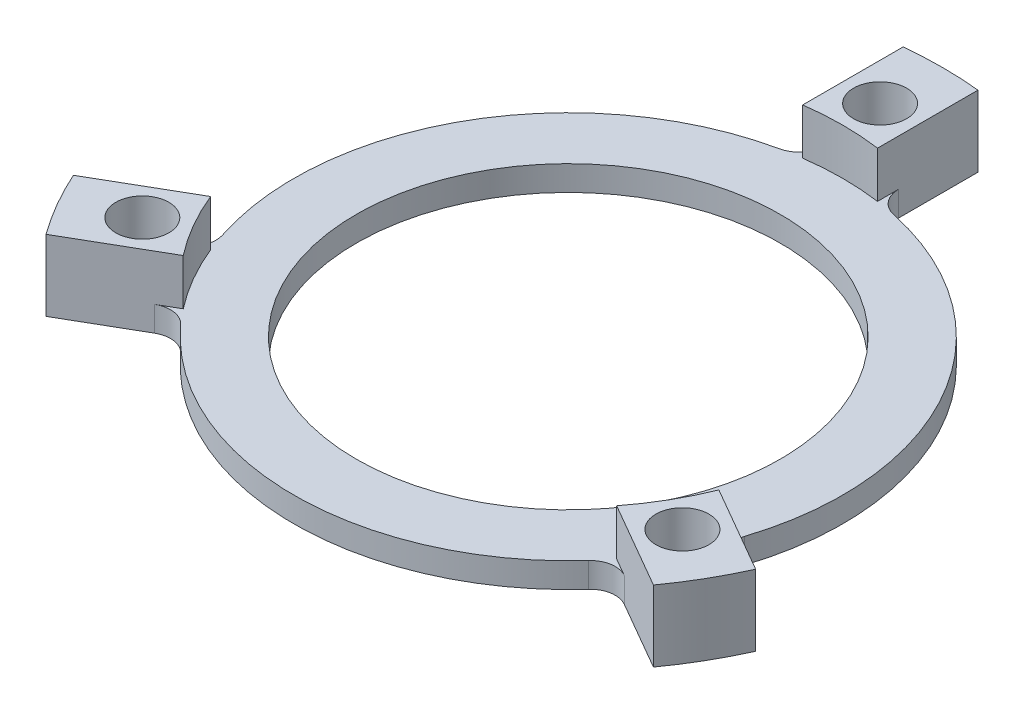
from build123d import *

# Parameters (mm, degrees)
SKETCH1_R             = 1.0635
BOSS_EXTRUDE1_DEPTH   = 2.85
BOSS_EXTRUDE1_2_DEPTH = 2.85
BOSS_EXTRUDE1_3_DEPTH = 2.85
SKETCH1_3_R           = 8.5
BOSS_EXTRUDE2_DEPTH   = 1
FILLET1_R             = 1


with BuildPart() as part:
    # Sketch1 → Boss-Extrude1 (new body)
    with BuildSketch(Plane(origin=(0, 0, 0), x_dir=(1, 0, 0), z_dir=(0, 1, 0))):
        with BuildLine():
            ThreePointArc((-1.5, 10.897247359), (0, 11), (1.5, 10.897247359))
            Line((1.5, 10.897247359), (1.5, 14.924811557))
            ThreePointArc((1.5, 14.924811557), (0, 15), (-1.5, 14.924811557))
            Line((-1.5, 14.924811557), (-1.5, 10.897247359))
        make_face()
        with Locations((0, 12.5)):
            Circle(SKETCH1_R, mode=Mode.SUBTRACT)
    extrude(amount=BOSS_EXTRUDE1_DEPTH)



with BuildPart() as body_2:
    # Sketch1 → Boss-Extrude1 2 (new body)
    with BuildSketch(Plane(origin=(0, 0, 0), x_dir=(1, 0, 0), z_dir=(0, 1, 0))):
        with BuildLine():
            ThreePointArc((-8.687293044, -6.747661785), (-9.526279442, -5.5), (-10.187293044, -4.149585574))
            Line((-10.187293044, -4.149585574), (-13.675265955, -6.163367673))
            ThreePointArc((-13.675265955, -6.163367673), (-12.990381057, -7.5), (-12.175265955, -8.761443884))
            Line((-12.175265955, -8.761443884), (-8.687293044, -6.747661785))
        make_face()
        with Locations((-10.825317547, -6.25)):
            Circle(SKETCH1_R, mode=Mode.SUBTRACT)
    extrude(amount=BOSS_EXTRUDE1_2_DEPTH)


with BuildPart() as body_3:
    # Sketch1 → Boss-Extrude1 3 (new body)
    with BuildSketch(Plane(origin=(0, 0, 0), x_dir=(1, 0, 0), z_dir=(0, 1, 0))):
        with BuildLine():
            Line((13.675265955, -6.163367673), (10.187293044, -4.149585574))
            ThreePointArc((10.187293044, -4.149585574), (9.526279442, -5.5), (8.687293044, -6.747661785))
            Line((8.687293044, -6.747661785), (12.175265955, -8.761443884))
            ThreePointArc((12.175265955, -8.761443884), (12.990381057, -7.5), (13.675265955, -6.163367673))
        make_face()
        with Locations((10.825317547, -6.25)):
            Circle(SKETCH1_R, mode=Mode.SUBTRACT)
    extrude(amount=BOSS_EXTRUDE1_3_DEPTH)


with BuildPart() as part_1:
    add(part.part)

    add(body_2.part)  # Boss-Extrude2 merges body 2

    add(body_3.part)  # Boss-Extrude2 merges body 3
    # Sketch1<3> → Boss-Extrude2 (add)
    with BuildSketch(Plane(origin=(0, 0, 0), x_dir=(1, 0, 0), z_dir=(0, 1, 0))):
        with BuildLine():
            ThreePointArc((1.5, 10.897247359), (0, 11), (-1.5, 10.897247359))
            ThreePointArc((-1.5, 10.897247359), (-9.526279442, 5.5), (-10.187293044, -4.149585574))
            ThreePointArc((-10.187293044, -4.149585574), (-9.526279442, -5.5), (-8.687293044, -6.747661785))
            ThreePointArc((-8.687293044, -6.747661785), (0, -11), (8.687293044, -6.747661785))
            ThreePointArc((8.687293044, -6.747661785), (9.526279442, -5.5), (10.187293044, -4.149585574))
            ThreePointArc((10.187293044, -4.149585574), (10.794911382, -2.114211025), (11, 0))
            ThreePointArc((11, 0), (8.291561976, 7.228416147), (1.5, 10.897247359))
        make_face()
        Circle(SKETCH1_3_R, mode=Mode.SUBTRACT)
    extrude(amount=BOSS_EXTRUDE2_DEPTH)

    # Fillet1
    fillet1_edges = [part_1.edges().sort_by_distance(p)[0] for p in [
        (1.5, 0.5, -10.897247359),
        (10.187293044, 0.5, 4.149585574),
        (8.687293044, 0.5, 6.747661785),
        (-1.5, 0.5, -10.897247359),
        (-10.187293044, 0.5, 4.149585574),
        (-8.687293044, 0.5, 6.747661785),
    ]]
    fillet(fillet1_edges, radius=FILLET1_R)


solid = part_1.part
